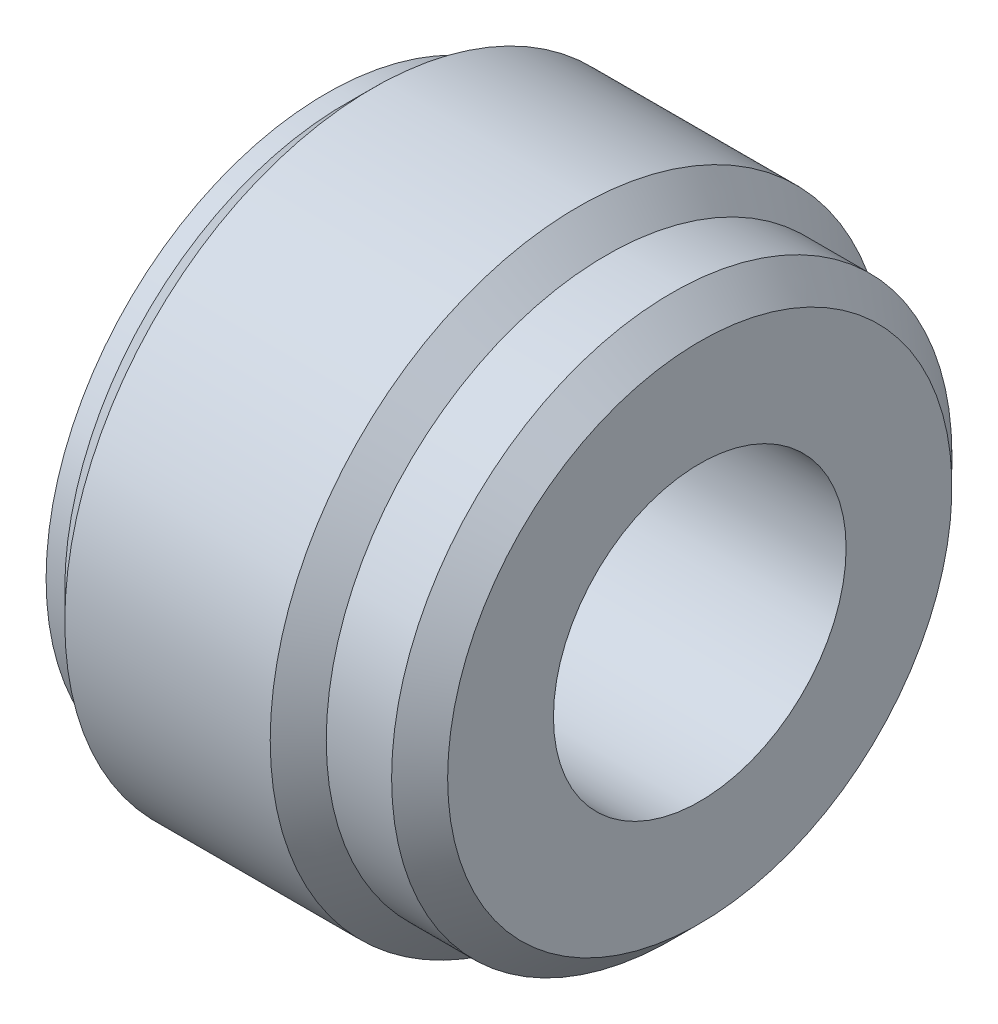
from build123d import *

# Parameters (mm, degrees)
TAP1_D        = 1.567
CHAMFER1_SIZE = 0.15


with BuildPart() as part:
    # Sketch1 → Revolve1 (revolve)
    with BuildSketch(Plane.XY, mode=Mode.PRIVATE) as revolve1_sk:
        Polygon((0, 0), (0, 1.5), (0.1, 1.5), (0.1, 1.65), (1.5, 1.65), (1.5, 1.5), (2, 1.5), (2, 0), align=None)
    revolve(revolve1_sk.sketch.rotate(Axis((-87.49, 0, 0), (1, 0, 0)), 90), axis=Axis((-87.49, 0, 0), (1, 0, 0)))

    # Tap1 (through all)
    with Locations(Plane.ZY):
        with Locations((0, 0)):
            Hole(TAP1_D / 2)

    # Chamfer1
    chamfer1_edges = [part.edges().sort_by_distance(p)[0] for p in [
        (2, 0, -1.5),
        (1.5, 0, -1.65),
        (0.1, 0, -1.65),
    ]]
    chamfer(chamfer1_edges, length=CHAMFER1_SIZE - 0.0001)  # a hair under: the kernel refuses the full size


solid = part.part
